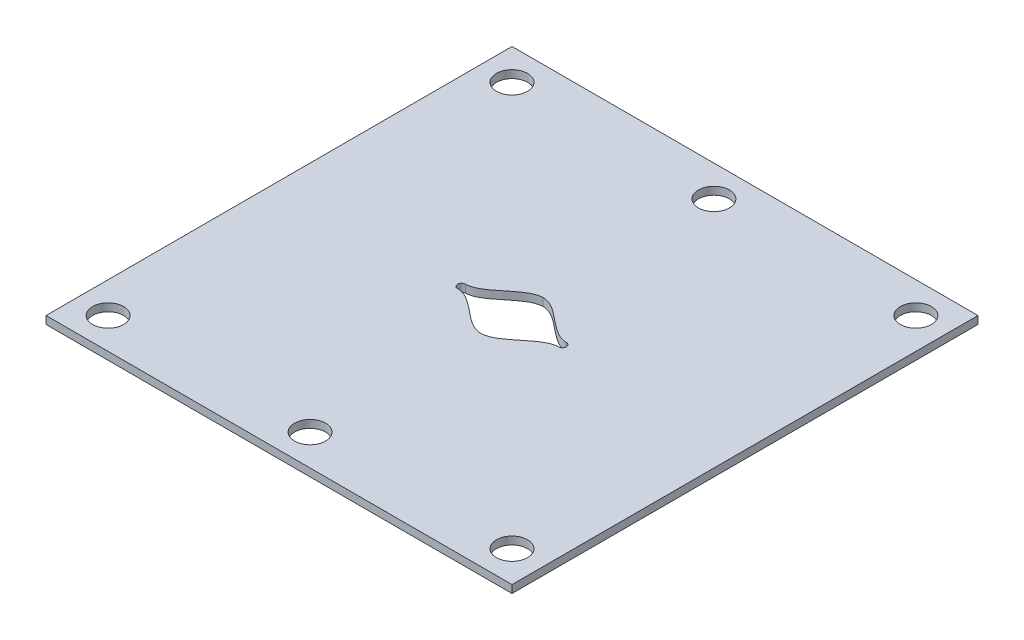
from build123d import *

# Parameters (mm, degrees)
SKETCH1_W                = 60
SKETCH1_H                = 60
BOSS_EXTRUDE1_DEPTH      = 1
F_4_0_4_DIAMETER_HOLE1_D = 4
ICELL_DEPTH              = 10


with BuildPart() as part:
    # Sketch1 → Boss-Extrude1 (new body)
    with BuildSketch(Plane(origin=(0, 0, 0), x_dir=(1, 0, 0), z_dir=(0, 1, 0))):
        Rectangle(SKETCH1_W, SKETCH1_H)
    extrude(amount=BOSS_EXTRUDE1_DEPTH)

    # Ø4.0 (4) Diameter Hole1 (through all)
    with Locations(Plane(origin=(0, 1, 0), x_dir=(1, 0, 0), z_dir=(0, 1, 0))):
        with Locations((26, 26), (0, 26), (-26, 26), (0, -26), (26, -26), (-26, -26)):
            Hole(F_4_0_4_DIAMETER_HOLE1_D / 2)

    # Sketch19 → iCell (cut)
    with BuildSketch(Plane(origin=(0, 1, 0), x_dir=(1, 0, 0), z_dir=(0, 1, 0))):
        with BuildLine():
            ThreePointArc((-6.5, -0.5), (-7, 0), (-6.5, 0.5))
            add(Edge.make_bspline(
                [(-6.5, 0.5), (-4.333333334, 0.5), (-2.166666667, 4.000004082), (-1e-09, 4.000013237)],
                knots=[0.083333333, 0.083333333, 0.083333333, 0.083333333, 0.916666667, 0.916666667, 0.916666667, 0.916666667], degree=3))
            add(Edge.make_bspline(
                [(6.499999999, 0.5), (4.333333333, 0.5), (2.166666666, 4.000004083), (-1e-09, 4.000013237)],
                knots=[0.083333333, 0.083333333, 0.083333333, 0.083333333, 0.916666667, 0.916666667, 0.916666667, 0.916666667], degree=3))
            ThreePointArc((6.499999999, 0.5), (6.999999999, 0), (6.499999999, -0.5))
            add(Edge.make_bspline(
                [(6.499999999, -0.5), (4.333333333, -0.5), (2.166666666, -4.000004083), (0, -4.000013237)],
                knots=[0.083333333, 0.083333333, 0.083333333, 0.083333333, 0.916666667, 0.916666667, 0.916666667, 0.916666667], degree=3))
            add(Edge.make_bspline(
                [(-6.5, -0.5), (-4.333333334, -0.5), (-2.166666667, -4.000004083), (0, -4.000013237)],
                knots=[0.083333333, 0.083333333, 0.083333333, 0.083333333, 0.916666667, 0.916666667, 0.916666667, 0.916666667], degree=3))
        make_face()
    extrude(amount=-ICELL_DEPTH, mode=Mode.SUBTRACT)


solid = part.part
